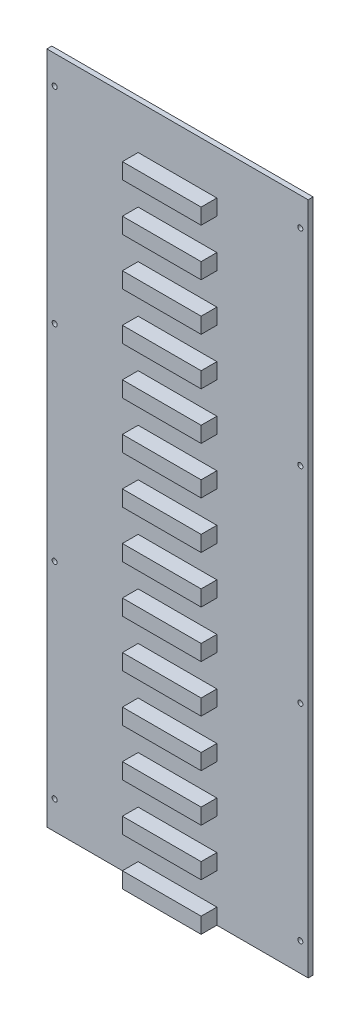
from build123d import *

# Parameters (mm, degrees)
SKETCH1_W                 = 83
SKETCH1_H                 = 214
BOSS_EXTRUDE1_DEPTH       = 1.5875
SKETCH2_W                 = 25
SKETCH2_H                 = 5
BOSS_EXTRUDE2_DEPTH       = 5
F_0_CLEARANCE_HOLE1_D     = 1.6129
F_0_CLEARANCE_HOLE1_DEPTH = 3.175
F_0_CLEARANCE_HOLE1_TIP   = 0.484564046


with BuildPart() as part:
    # Sketch1 → Boss-Extrude1 (new body)
    with BuildSketch(Plane.XY):
        Rectangle(SKETCH1_W, SKETCH1_H)
    extrude(amount=BOSS_EXTRUDE1_DEPTH)

    # Sketch2 → Boss-Extrude2 (add)
    with BuildSketch(Plane.XY.offset(1.5875)):
        with Locations((0, 90.5)):
            Rectangle(SKETCH2_W, SKETCH2_H)
        with Locations((0, 75.5)):
            Rectangle(SKETCH2_W, SKETCH2_H)
        with Locations((0, 60.5)):
            Rectangle(SKETCH2_W, SKETCH2_H)
        with Locations((0, 45.5)):
            Rectangle(SKETCH2_W, SKETCH2_H)
        with Locations((0, 30.5)):
            Rectangle(SKETCH2_W, SKETCH2_H)
        with Locations((0, 15.5)):
            Rectangle(SKETCH2_W, SKETCH2_H)
        with Locations((0, 0.5)):
            Rectangle(SKETCH2_W, SKETCH2_H)
        with Locations((0, -14.5)):
            Rectangle(SKETCH2_W, SKETCH2_H)
        with Locations((0, -29.5)):
            Rectangle(SKETCH2_W, SKETCH2_H)
        with Locations((0, -44.5)):
            Rectangle(SKETCH2_W, SKETCH2_H)
        with Locations((0, -59.5)):
            Rectangle(SKETCH2_W, SKETCH2_H)
        with Locations((0, -74.5)):
            Rectangle(SKETCH2_W, SKETCH2_H)
        with Locations((0, -89.5)):
            Rectangle(SKETCH2_W, SKETCH2_H)
        with Locations((0, -104.5)):
            Rectangle(SKETCH2_W, SKETCH2_H)
    extrude(amount=BOSS_EXTRUDE2_DEPTH)

    # #0 Clearance Hole1
    with Locations(Plane.XY.offset(1.5875)):
        with Locations((-39, 98), (39, 98), (-39, 32.666666667), (39, 32.666666667), (-39, -32.666666667), (39, -32.666666667), (-39, -98), (39, -98)):
            Hole(F_0_CLEARANCE_HOLE1_D / 2, depth=F_0_CLEARANCE_HOLE1_DEPTH)
            with Locations((0, 0, -(F_0_CLEARANCE_HOLE1_DEPTH + F_0_CLEARANCE_HOLE1_TIP / 2))):  # 118° drill point
                Cone(0, F_0_CLEARANCE_HOLE1_D / 2, F_0_CLEARANCE_HOLE1_TIP, mode=Mode.SUBTRACT)


solid = part.part
